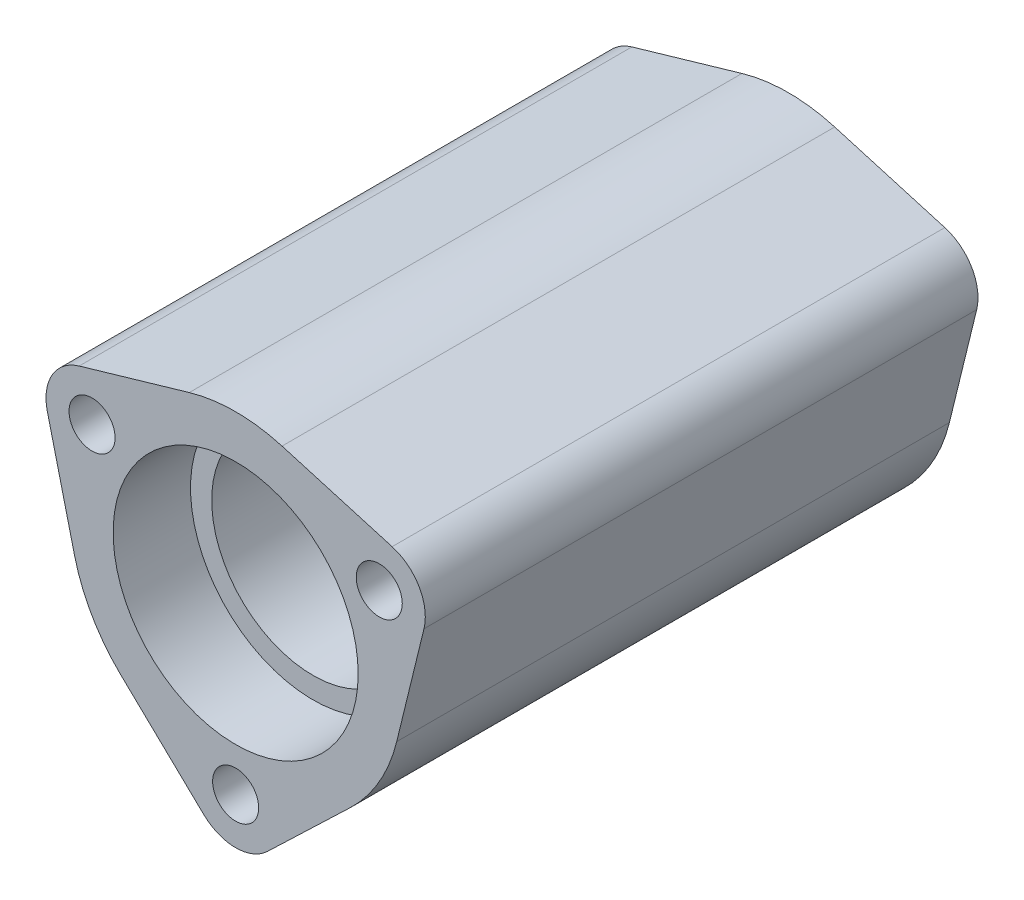
from build123d import *

# Parameters (mm, degrees)
EXTRUDE_693_DEPTH      = 15
EXTRUDE_693_DEPTH_BACK = 15
SKETCH_2_R             = 6.65
CUT_EXTRUDE_968_DEPTH  = 4.2
SKETCH_3_R             = 5.5
CUT_EXTRUDE_1076_DEPTH = 31.064283513
SKETCH_4_R             = 1.25
CUT_EXTRUDE_1423_DEPTH = 34.737533152


with BuildPart() as part:
    # Эскиз1 → Extrude 693 (new, two sides: drawn at the far end of the back side and taken through both)
    with BuildSketch(Plane.XY.offset(-EXTRUDE_693_DEPTH_BACK)):
        with BuildLine():
            Line((-8.493309252, 6.900267962), (-2.516690225, 8.640964663))
            ThreePointArc((-2.516690225, 8.640964663), (0, 9), (2.516690225, 8.640964663))
            Line((2.516690225, 8.640964663), (8.493309252, 6.900267962))
            ThreePointArc((8.493309252, 6.900267962), (9.959292144, 5.75), (10.222461974, 3.905287594))
            Line((10.222461974, 3.905287594), (8.741640024, -2.140964663))
            ThreePointArc((8.741640024, -2.140964663), (7.794228634, -4.5), (6.224949799, -6.5))
            Line((6.224949799, -6.5), (1.729152722, -10.805555556))
            ThreePointArc((1.729152722, -10.805555556), (0, -11.5), (-1.729152722, -10.805555556))
            Line((-1.729152722, -10.805555556), (-6.224949799, -6.5))
            ThreePointArc((-6.224949799, -6.5), (-7.794228634, -4.5), (-8.741640024, -2.140964663))
            Line((-8.741640024, -2.140964663), (-10.222461974, 3.905287594))
            ThreePointArc((-10.222461974, 3.905287594), (-9.959292144, 5.75), (-8.493309252, 6.900267962))
        make_face()
    extrude(amount=EXTRUDE_693_DEPTH + EXTRUDE_693_DEPTH_BACK)

    # Эскиз2 → Cut-Extrude 968 (cut)
    with BuildSketch(Plane.XY.offset(15)):
        Circle(SKETCH_2_R)
    cut_extrude_968 = extrude(amount=-CUT_EXTRUDE_968_DEPTH, mode=Mode.SUBTRACT)

    # Зеркальное отражение1: Cut-Extrude 968 across plane
    add(cut_extrude_968.mirror(Plane.XY), mode=Mode.SUBTRACT)

    # Эскиз3 → Cut-Extrude 1076 (cut, through all)
    with BuildSketch(Plane.XY.offset(10.8)):
        Circle(SKETCH_3_R)
    extrude(amount=-CUT_EXTRUDE_1076_DEPTH, mode=Mode.SUBTRACT)

    # Эскиз4 → Cut-Extrude 1423 (cut, through all)
    with BuildSketch(Plane.XY.offset(15)):
        with Locations((-7.794228634, 4.5)):
            Circle(SKETCH_4_R)
        with Locations((0, -9)):
            Circle(SKETCH_4_R)
        with Locations((7.794228634, 4.5)):
            Circle(SKETCH_4_R)
    extrude(amount=-CUT_EXTRUDE_1423_DEPTH, mode=Mode.SUBTRACT)


solid = part.part
